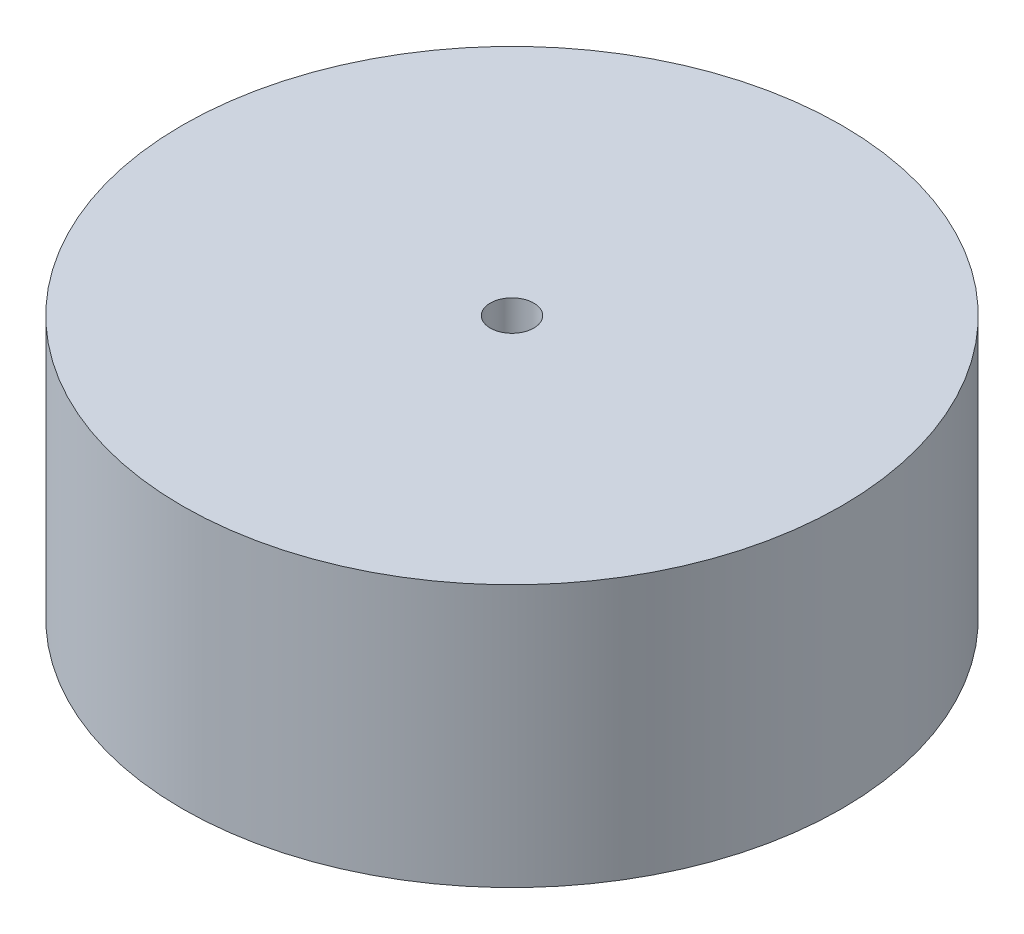
from build123d import *

# Parameters (mm, degrees)
SKETCH1_R           = 22
BOSS_EXTRUDE1_DEPTH = 17.5
CUT_EXTRUDE1_REACH  = 37.697
SKETCH2_R           = 1.45


with BuildPart() as part:
    # Sketch1 → Boss-Extrude1 (new body)
    with BuildSketch(Plane(origin=(0, 0, 0), x_dir=(1, 0, 0), z_dir=(0, 1, 0))):
        Circle(SKETCH1_R)
    extrude(amount=BOSS_EXTRUDE1_DEPTH)

    # Sketch2 → Cut-Extrude1 (cut, up to next)
    with BuildSketch(Plane(origin=(0, 17.5, 0), x_dir=(1, 0, 0), z_dir=(0, 1, 0)), mode=Mode.PRIVATE) as cut_extrude1_sk1:
        Circle(SKETCH2_R)
    cut_extrude1_tool1 = extrude(cut_extrude1_sk1.sketch, amount=-CUT_EXTRUDE1_REACH, mode=Mode.PRIVATE) & part.part
    add(cut_extrude1_tool1.solids().sort_by_distance((0, 17.5, 0))[0], mode=Mode.SUBTRACT)


solid = part.part
